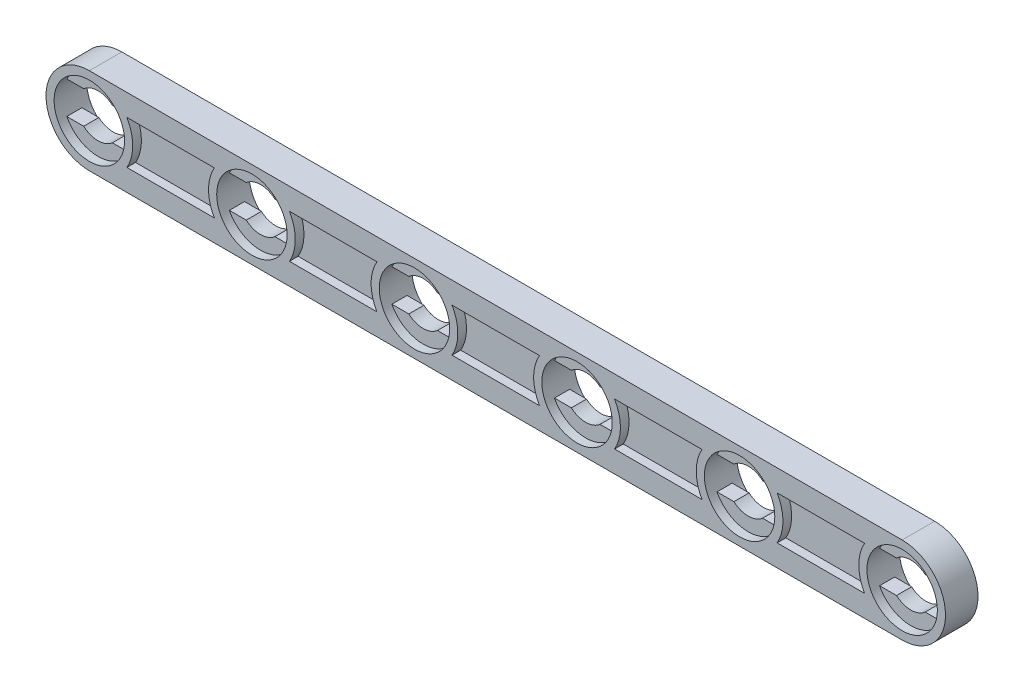
from build123d import *

# Parameters (mm, degrees)
EXTRUDE_1_DEPTH          = 3
CUT_EXTRUDE_1_REACH      = 81.158
SKETCH_3_R               = 3.25
CUT_EXTRUDE_2_DEPTH      = 0.8
CUT_EXTRUDE_START        = -2.2
SKETCH_3_2_R             = 3.25
CUT_EXTRUDE_3_DEPTH      = 0.8
CUT_EXTRUDE_4_DEPTH      = 0.8
SKETCH_5_W               = 7
SKETCH_5_H               = 4
CUT_EXTRUDE_6_DEPTH      = 0.8
MIRROR_8_COPY_1_REACH    = 81.158
MIRROR_8_COPY_2_SKETCH_R = 3.25
MIRROR_8_COPY_2_DEPTH    = 0.8
MIRROR_START             = -2.2
MIRROR_8_COPY_3_SKETCH_R = 3.25
MIRROR_8_COPY_3_DEPTH    = 0.8
MIRROR_8_COPY_4_DEPTH    = 0.8
MIRROR_8_COPY_5_SKETCH_W = 7
MIRROR_8_COPY_5_SKETCH_H = 4
MIRROR_8_COPY_5_DEPTH    = 0.8
MIRROR_8_COPY_6_REACH    = 81.158
MIRROR_8_COPY_7_SKETCH_R = 3.25
MIRROR_8_COPY_7_DEPTH    = 0.8
MIRROR_8_COPY_8_SKETCH_R = 3.25
MIRROR_8_COPY_8_DEPTH    = 0.8


with BuildPart() as part:
    # 草图1 → 凸台-拉伸1 (new body)
    with BuildSketch(Plane.XY):
        with BuildLine():
            Line((0, 4), (75, 4))
            ThreePointArc((75, 4), (79, 0), (75, -4))
            Line((75, -4), (0, -4))
            ThreePointArc((0, -4), (-4, 0), (0, 4))
        make_face()
    extrude(amount=-EXTRUDE_1_DEPTH)

    # 草图2 → 切除-拉伸1 (cut, up to next)
    with BuildSketch(Plane.XY, mode=Mode.PRIVATE) as cut_extrude_1_sk1:
        with BuildLine():
            Line((1.322875656, -1.5), (2.883140649, -1.5))
            ThreePointArc((2.883140649, -1.5), (3.25, 0), (2.883140649, 1.5))
            Line((2.883140649, 1.5), (1.322875656, 1.5))
            ThreePointArc((1.322875656, 1.5), (0, 2), (-1.322875656, 1.5))
            Line((-1.322875656, 1.5), (-2.883140649, 1.5))
            ThreePointArc((-2.883140649, 1.5), (-3.25, 0), (-2.883140649, -1.5))
            Line((-2.883140649, -1.5), (-1.322875656, -1.5))
            ThreePointArc((-1.322875656, -1.5), (0, -2), (1.322875656, -1.5))
        make_face()
    cut_extrude_1_tool1 = extrude(cut_extrude_1_sk1.sketch, amount=-CUT_EXTRUDE_1_REACH, mode=Mode.PRIVATE) & part.part
    cut_extrude_1 = cut_extrude_1_tool1.solids().sort_by_distance((0, 0, 0))[0]
    add(cut_extrude_1, mode=Mode.SUBTRACT)

    # 草图3 → 切除-拉伸2 (cut)
    with BuildSketch(Plane.XY):
        Circle(SKETCH_3_R)
    cut_extrude_2 = extrude(amount=-CUT_EXTRUDE_2_DEPTH, mode=Mode.SUBTRACT)

    # 草图3<2> → 切除-拉伸3 (cut)
    with BuildSketch(Plane.XY.offset(CUT_EXTRUDE_START)):
        Circle(SKETCH_3_2_R)
    cut_extrude_3 = extrude(amount=-CUT_EXTRUDE_3_DEPTH, mode=Mode.SUBTRACT)

    # 草图4 → 切除-拉伸4 (cut)
    with BuildSketch(Plane.XY):
        with BuildLine():
            Line((3.464101615, 2), (11.535898385, 2))
            ThreePointArc((11.535898385, 2), (11, 0), (11.535898385, -2))
            Line((11.535898385, -2), (3.464101615, -2))
            ThreePointArc((3.464101615, -2), (4, 0), (3.464101615, 2))
        make_face()
    cut_extrude_4 = extrude(amount=-CUT_EXTRUDE_4_DEPTH, mode=Mode.SUBTRACT)

    # 草图5 → 切除-拉伸6 (cut)
    with BuildSketch(Plane(origin=(0, 0, -3), x_dir=(-1, 0, 0), z_dir=(0, 0, -1))):
        with Locations((-7.5, 0)):
            Rectangle(SKETCH_5_W, SKETCH_5_H)
    cut_extrude_6 = extrude(amount=-CUT_EXTRUDE_6_DEPTH, mode=Mode.SUBTRACT)

    # 镜向1: 切除-拉伸1, 切除-拉伸2, 切除-拉伸3 across plane
    add(cut_extrude_1.mirror(Plane(origin=(7.5, 0, 0), x_dir=(0, 0, 1), z_dir=(1, 0, 0))), mode=Mode.SUBTRACT)
    add(cut_extrude_2.mirror(Plane(origin=(7.5, 0, 0), x_dir=(0, 0, 1), z_dir=(1, 0, 0))), mode=Mode.SUBTRACT)
    add(cut_extrude_3.mirror(Plane(origin=(7.5, 0, 0), x_dir=(0, 0, 1), z_dir=(1, 0, 0))), mode=Mode.SUBTRACT)

    # 镜向3: 切除-拉伸4, 切除-拉伸6 across plane
    add(cut_extrude_4.mirror(Plane(origin=(15, 0, 0), x_dir=(0, 0, 1), z_dir=(1, 0, 0))), mode=Mode.SUBTRACT)
    add(cut_extrude_6.mirror(Plane(origin=(15, 0, 0), x_dir=(0, 0, 1), z_dir=(1, 0, 0))), mode=Mode.SUBTRACT)

    # 镜向4: 切除-拉伸4, 切除-拉伸6 across plane
    add(cut_extrude_4.mirror(Plane(origin=(22.5, 0, 0), x_dir=(0, 0, 1), z_dir=(1, 0, 0))), mode=Mode.SUBTRACT)
    add(cut_extrude_6.mirror(Plane(origin=(22.5, 0, 0), x_dir=(0, 0, 1), z_dir=(1, 0, 0))), mode=Mode.SUBTRACT)

    # 镜向7: 切除-拉伸1, 切除-拉伸2, 切除-拉伸3 across plane
    add(cut_extrude_1.mirror(Plane(origin=(15, 0, 0), x_dir=(0, 0, 1), z_dir=(1, 0, 0))), mode=Mode.SUBTRACT)
    add(cut_extrude_2.mirror(Plane(origin=(15, 0, 0), x_dir=(0, 0, 1), z_dir=(1, 0, 0))), mode=Mode.SUBTRACT)
    add(cut_extrude_3.mirror(Plane(origin=(15, 0, 0), x_dir=(0, 0, 1), z_dir=(1, 0, 0))), mode=Mode.SUBTRACT)

    # 镜向8: 切除-拉伸1, 切除-拉伸2, 切除-拉伸3, 切除-拉伸4, 切除-拉伸6 across plane
    add(cut_extrude_1.mirror(Plane(origin=(37.5, 0, 0), x_dir=(0, 0, 1), z_dir=(1, 0, 0))), mode=Mode.SUBTRACT)
    add(cut_extrude_2.mirror(Plane(origin=(37.5, 0, 0), x_dir=(0, 0, 1), z_dir=(1, 0, 0))), mode=Mode.SUBTRACT)
    add(cut_extrude_3.mirror(Plane(origin=(37.5, 0, 0), x_dir=(0, 0, 1), z_dir=(1, 0, 0))), mode=Mode.SUBTRACT)
    add(cut_extrude_4.mirror(Plane(origin=(37.5, 0, 0), x_dir=(0, 0, 1), z_dir=(1, 0, 0))), mode=Mode.SUBTRACT)
    add(cut_extrude_6.mirror(Plane(origin=(37.5, 0, 0), x_dir=(0, 0, 1), z_dir=(1, 0, 0))), mode=Mode.SUBTRACT)

    # 镜向8 copy 1 sketch → 镜向8 copy 1 (cut, up to next)
    with BuildSketch(Plane(origin=(60, 0, 0), x_dir=(1, 0, 0), z_dir=(0, 0, 1)), mode=Mode.PRIVATE) as mirror_8_copy_1_sk1:
        with BuildLine():
            Line((1.322875656, -1.5), (2.883140649, -1.5))
            ThreePointArc((2.883140649, -1.5), (3.25, 0), (2.883140649, 1.5))
            Line((2.883140649, 1.5), (1.322875656, 1.5))
            ThreePointArc((1.322875656, 1.5), (0, 2), (-1.322875656, 1.5))
            Line((-1.322875656, 1.5), (-2.883140649, 1.5))
            ThreePointArc((-2.883140649, 1.5), (-3.25, 0), (-2.883140649, -1.5))
            Line((-2.883140649, -1.5), (-1.322875656, -1.5))
            ThreePointArc((-1.322875656, -1.5), (0, -2), (1.322875656, -1.5))
        make_face()
    mirror_8_copy_1_tool1 = extrude(mirror_8_copy_1_sk1.sketch, amount=-MIRROR_8_COPY_1_REACH, mode=Mode.PRIVATE) & part.part
    add(mirror_8_copy_1_tool1.solids().sort_by_distance((60, 0, 0))[0], mode=Mode.SUBTRACT)

    # 镜向8 copy 2 sketch → 镜向8 copy 2 (cut)
    with BuildSketch(Plane(origin=(60, 0, 0), x_dir=(1, 0, 0), z_dir=(0, 0, 1))):
        Circle(MIRROR_8_COPY_2_SKETCH_R)
    extrude(amount=-MIRROR_8_COPY_2_DEPTH, mode=Mode.SUBTRACT)

    # 镜向8 copy 3 sketch → 镜向8 copy 3 (cut)
    with BuildSketch(Plane(origin=(60, 0, 0), x_dir=(1, 0, 0), z_dir=(0, 0, 1)).offset(MIRROR_START)):
        Circle(MIRROR_8_COPY_3_SKETCH_R)
    extrude(amount=-MIRROR_8_COPY_3_DEPTH, mode=Mode.SUBTRACT)

    # 镜向8 copy 4 sketch → 镜向8 copy 4 (cut)
    with BuildSketch(Plane(origin=(45, 0, 0), x_dir=(1, 0, 0), z_dir=(0, 0, 1))):
        with BuildLine():
            Line((3.464101615, 2), (11.535898385, 2))
            ThreePointArc((11.535898385, 2), (11, 0), (11.535898385, -2))
            Line((11.535898385, -2), (3.464101615, -2))
            ThreePointArc((3.464101615, -2), (4, 0), (3.464101615, 2))
        make_face()
    extrude(amount=-MIRROR_8_COPY_4_DEPTH, mode=Mode.SUBTRACT)

    # 镜向8 copy 5 sketch → 镜向8 copy 5 (cut)
    with BuildSketch(Plane(origin=(45, 0, -3), x_dir=(-1, 0, 0), z_dir=(0, 0, -1))):
        with Locations((-7.5, 0)):
            Rectangle(MIRROR_8_COPY_5_SKETCH_W, MIRROR_8_COPY_5_SKETCH_H)
    extrude(amount=-MIRROR_8_COPY_5_DEPTH, mode=Mode.SUBTRACT)

    # 镜向8 copy 6 sketch → 镜向8 copy 6 (cut, up to next)
    with BuildSketch(Plane(origin=(45, 0, 0), x_dir=(1, 0, 0), z_dir=(0, 0, 1)), mode=Mode.PRIVATE) as mirror_8_copy_6_sk1:
        with BuildLine():
            Line((1.322875656, -1.5), (2.883140649, -1.5))
            ThreePointArc((2.883140649, -1.5), (3.25, 0), (2.883140649, 1.5))
            Line((2.883140649, 1.5), (1.322875656, 1.5))
            ThreePointArc((1.322875656, 1.5), (0, 2), (-1.322875656, 1.5))
            Line((-1.322875656, 1.5), (-2.883140649, 1.5))
            ThreePointArc((-2.883140649, 1.5), (-3.25, 0), (-2.883140649, -1.5))
            Line((-2.883140649, -1.5), (-1.322875656, -1.5))
            ThreePointArc((-1.322875656, -1.5), (0, -2), (1.322875656, -1.5))
        make_face()
    mirror_8_copy_6_tool1 = extrude(mirror_8_copy_6_sk1.sketch, amount=-MIRROR_8_COPY_6_REACH, mode=Mode.PRIVATE) & part.part
    add(mirror_8_copy_6_tool1.solids().sort_by_distance((45, 0, 0))[0], mode=Mode.SUBTRACT)

    # 镜向8 copy 7 sketch → 镜向8 copy 7 (cut)
    with BuildSketch(Plane(origin=(45, 0, 0), x_dir=(1, 0, 0), z_dir=(0, 0, 1))):
        Circle(MIRROR_8_COPY_7_SKETCH_R)
    extrude(amount=-MIRROR_8_COPY_7_DEPTH, mode=Mode.SUBTRACT)

    # 镜向8 copy 8 sketch → 镜向8 copy 8 (cut)
    with BuildSketch(Plane(origin=(45, 0, 0), x_dir=(1, 0, 0), z_dir=(0, 0, 1)).offset(MIRROR_START)):
        Circle(MIRROR_8_COPY_8_SKETCH_R)
    extrude(amount=-MIRROR_8_COPY_8_DEPTH, mode=Mode.SUBTRACT)


solid = part.part
